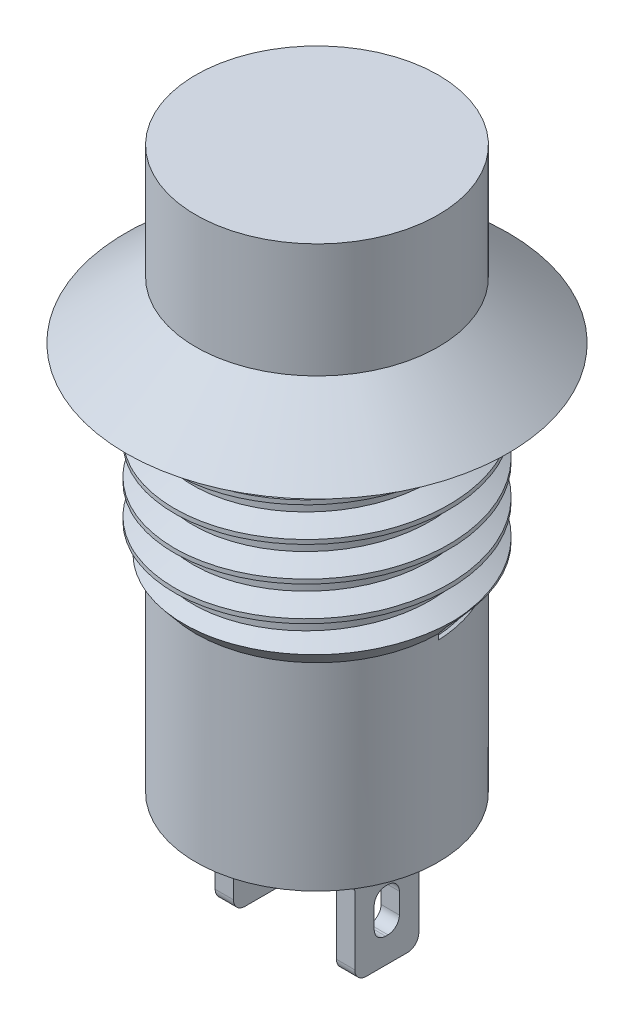
from build123d import *

# Parameters (mm, degrees)
THREAD1_PITCH           = 1.5
SKETCH6_W               = 0.8
SKETCH6_H               = 5
BOSS_EXTRUDE1_DEPTH     = 5
CUT_EXTRUDE1_DEPTH      = 29.283078049
CUT_EXTRUDE1_DEPTH_BACK = 29.283078049
SKETCH7_W               = 1.1
SKETCH7_H               = 4
SKETCH7_H_2             = 1.9
FILLET1_R               = 0.5


with BuildPart() as part:
    # Sketch2 → Revolve1 (revolve)
    with BuildSketch(Plane(origin=(0, 0, 0), x_dir=(0, 0, -1), z_dir=(1, 0, 0))):
        Polygon((8.35, 17), (5.3, 19.5), (5.3, 24.5), (0, 24.5), (0, 19.5), (0, 0), (5.3, 0), (5.3, 8.646), (6, 9.5), (6, 17), align=None)
    revolve(axis=Axis((0, 0, 0), (0, 1, 0)))

    # Thread1: arcs per turn and ends read off the stored shape
    # Thread1: the profile of Thread Profile1 profile screwed along a right-hand helix through 6 turns, 8 arcs to a turn; built about Z, then put on its axis
    thread1_z = Axis((0, 0, 0), (0, 0, 1))
    thread1_corners = [(6.0003, 0, -9.000173205), (6.0003, 0, -7.687326799), (5.188101188, 0, -8.156250002), (5.188101188, 0, -8.531250002)]
    with BuildLine(mode=Mode.PRIVATE) as thread1_profile:
        Line(thread1_corners[0], thread1_corners[1])
        Line(thread1_corners[1], thread1_corners[2])
        Line(thread1_corners[2], thread1_corners[3])
        Line(thread1_corners[3], thread1_corners[0])
    thread1_cap = Face(thread1_profile.wire())
    thread1_turn_angles = [0, 22.5, 45, 67.5, 90, 112.5, 135, 157.5, 180, 202.5, 225, 247.5, 270, 292.5, 315, 337.5, 360]
    thread1_turn_weights = [1, 0.9238795325112867, 1, 0.9238795325112867, 1, 0.9238795325112867, 1, 0.9238795325112867, 1, 0.9238795325112867, 1, 0.9238795325112867, 1, 0.9238795325112867, 1, 0.9238795325112867, 1]
    thread1_turn_rails = [Edge.make_bspline([Vector(p[0], p[1], 0).rotate(thread1_z, thread1_turn_angles[k]) / thread1_turn_weights[k] + Vector(0, 0, p[2] + THREAD1_PITCH * thread1_turn_angles[k] / 360) for k in range(17)], [0, 0, 0, 1, 1, 2, 2, 3, 3, 4, 4, 5, 5, 6, 6, 7, 7, 8, 8, 8], 2, thread1_turn_weights) for p in thread1_corners]
    thread1_turn_sides = [Face.make_surface_from_curves(thread1_turn_rails[p[0]], thread1_turn_rails[p[1]]) for p in [(0, 1), (1, 2), (2, 3), (3, 0)]]
    thread1 = Plane(origin=(0, 17, 0), x_dir=(1, 0, 0), z_dir=(0, 1, 0)) * Solid(Shell([*[p.moved(Location((0, 0, THREAD1_PITCH * i))) for i in range(6) for p in thread1_turn_sides], thread1_cap, thread1_cap.rotate(thread1_z, 2160).moved(Location((0, 0, THREAD1_PITCH * 2160 / 360)))]))
    add(thread1, mode=Mode.SUBTRACT)

    # Sketch6 → Boss-Extrude1 (add)
    with BuildSketch(Plane.XZ):
        with Locations((-2.65, 0)):
            Rectangle(SKETCH6_W, SKETCH6_H)
        with Locations((2.65, 0)):
            Rectangle(SKETCH6_W, SKETCH6_H)
    extrude(amount=BOSS_EXTRUDE1_DEPTH)

    # Sketch7 → Cut-Extrude1 (cut, two sides: drawn at the far end of the back side and taken through both)
    with BuildSketch(Plane(origin=(3.05, 0, 0), x_dir=(0, 0, -1), z_dir=(1, 0, 0)).offset(-CUT_EXTRUDE1_DEPTH_BACK)):
        with Locations((-1.95, -3)):
            Rectangle(SKETCH7_W, SKETCH7_H)
        with Locations((0, -2.95)):
            Rectangle(SKETCH7_W, SKETCH7_H_2)
        with Locations((1.95, -3)):
            Rectangle(SKETCH7_W, SKETCH7_H)
    extrude(amount=CUT_EXTRUDE1_DEPTH + CUT_EXTRUDE1_DEPTH_BACK, mode=Mode.SUBTRACT)

    # Fillet1
    fillet1_edges = [part.edges().sort_by_distance(p)[0] for p in [
        (-2.65, -1, -1.4),
        (2.65, -1, -1.4),
        (-2.65, -1, -2.5),
        (2.65, -1, -2.5),
        (-2.65, -5, -1.4),
        (-2.65, -3.9, 0.55),
        (2.65, -3.9, 0.55),
        (-2.65, -2, 0.55),
        (2.65, -2, 0.55),
        (-2.65, -2, -0.55),
        (2.65, -2, -0.55),
        (-2.65, -3.9, -0.55),
        (2.65, -3.9, -0.55),
        (2.65, -5, -1.4),
        (2.65, -5, 1.4),
        (-2.65, -1, 2.5),
        (2.65, -1, 2.5),
        (-2.65, -5, 1.4),
        (-2.65, -1, 1.4),
        (2.65, -1, 1.4),
    ]]
    fillet(fillet1_edges, radius=FILLET1_R)


solid = part.part
